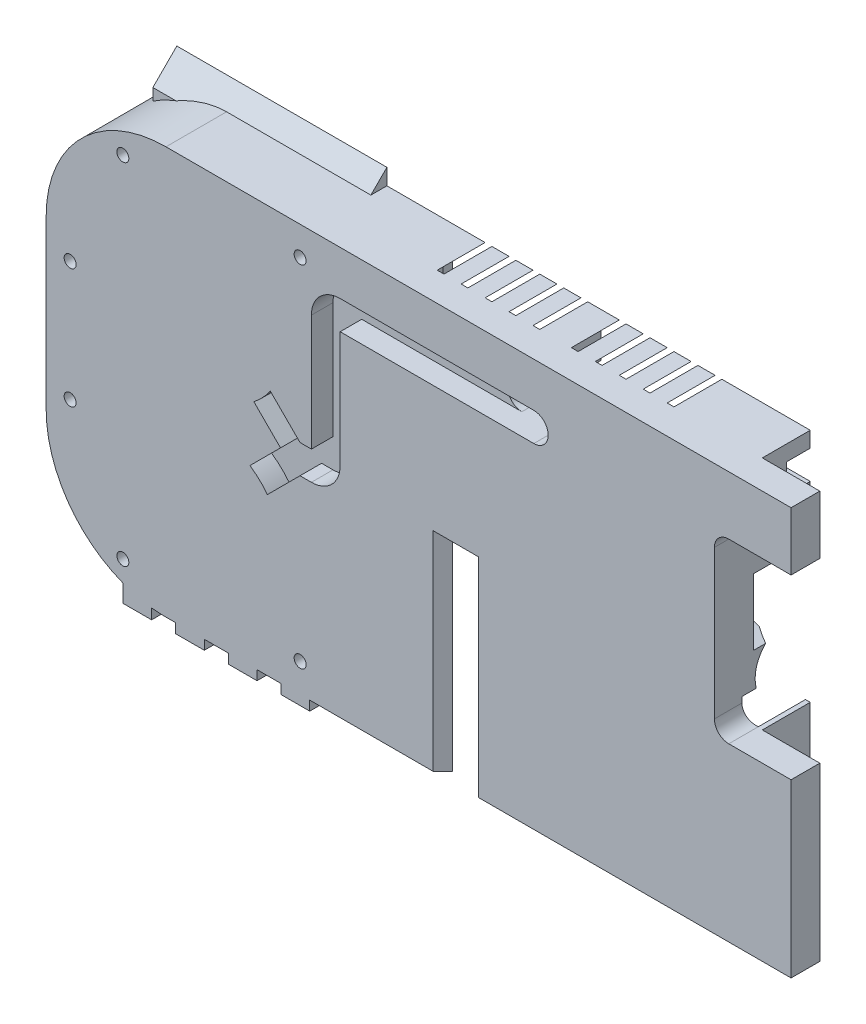
from build123d import *

# Parameters (mm, degrees)
BODY_DEPTH                    = 16
SKETCH24_W                    = 12
SKETCH24_H                    = 12.169980526
SKETCH24_H_2                  = 35.830019474
HANDLE_MATE_DEPTH             = 10
AIM_START                     = -5
AIM_DEPTH                     = 5
AIM_START_2                   = -11.5137
AIM_CHAMF_DEPTH               = 0.5137
AIM_START_3                   = -17
AIM_CHAMF_2_DEPTH             = 5.4863
AIM_START_4                   = -89.369387646
AIM_CHAMF_3_DEPTH             = 43.844504749
CLIP_BODY_CLEARANCE_DEPTH     = 40
CLIP_HEAD_CLEARANCE_DEPTH     = 13
CLIP_WINDOW_REACH             = 162.768
SKETCH30_W                    = 5.5
SKETCH30_H                    = 41.5
CLIP_WINDOW_CHAMF_SIZE        = 2
CLIP_SCREW_M3_D               = 2.5
CLIP_SCREW_M3_DEPTH           = 16
CLIP_SCREW_M3_TIP             = 0.751075774
DART_CLEARANCE_REACH          = 201.715
SKETCH6_R                     = 7.5
SKETCH15_R                    = 6.85
DRIVE_PULLEY_CLEARANCE_DEPTH  = 5.5
SKETCH16_R                    = 4.995
DRIVE_BEARING_CLEARANCE_DEPTH = 14
ESC_WIRE_GUIDE_DEPTH          = 4.5
ESC_WIRE_FEEDTROUGH_REACH     = 162.383
ESC_CLEARANCE_DEPTH           = 10
ESC_WIRE_CLEARANCE_DEPTH      = 5
BODY_SCREW_M3_D               = 2.5
CUT_EXTRUDE1_DEPTH            = 4
DRIVE_MOTOR_SCREW_D           = 2.5
DRIVE_MOTOR_SCREW_DEPTH       = 11
DRIVE_MOTOR_SCREW_TIP         = 0.751075774
DRIVE_MOTOR_EAR_DEPTH         = 3.8


with BuildPart() as part:
    # Sketch2 → body (new body)
    with BuildSketch(Plane.XY):
        with BuildLine():
            Line((-75.634238464, 36), (-73.634238464, 36))
            Line((-73.634238464, 36), (-73.634238464, 34))
            Line((-73.634238464, 34), (-67.634238464, 34))
            Line((-67.634238464, 34), (-67.634238464, 36))
            Line((-67.634238464, 36), (-62.634238464, 36))
            Line((-62.634238464, 36), (-62.634238464, 34))
            Line((-62.634238464, 34), (-56.634238464, 34))
            Line((-56.634238464, 34), (-56.634238464, 36))
            Line((-56.634238464, 36), (-51.634238464, 36))
            Line((-51.634238464, 36), (-51.634238464, 34))
            Line((-51.634238464, 34), (-45.634238464, 34))
            Line((-45.634238464, 34), (-45.634238464, 36))
            Line((-45.634238464, 36), (54.822790886, 36))
            Line((54.822790886, 36), (54.822790886, 66.789018034))
            Line((54.822790886, 66.789018034), (54.822790886, 71.830019474))
            Line((54.822790886, 71.830019474), (41.822790886, 71.830019474))
            ThreePointArc((41.822790886, 71.830019474), (39.701470543, 72.708699131), (38.822790886, 74.830019474))
            Line((38.822790886, 74.830019474), (38.822790886, 105.830019474))
            ThreePointArc((38.822790886, 105.830019474), (39.701470543, 107.951339818), (41.822790886, 108.830019474))
            Line((41.822790886, 108.830019474), (54.822790886, 108.830019474))
            Line((54.822790886, 108.830019474), (54.822790886, 121))
            Line((54.822790886, 121), (-75.634238464, 121))
            ThreePointArc((-75.634238464, 121), (-93.311907994, 113.67766953), (-100.634238464, 96))
            Line((-100.634238464, 96), (-100.634238464, 61))
            ThreePointArc((-100.634238464, 61), (-96.249766592, 46.857864376), (-84.634238464, 37.676192421))
            Line((-84.634238464, 37.676192421), (-84.634238464, 34))
            Line((-84.634238464, 34), (-78.634238464, 34))
            Line((-78.634238464, 34), (-78.634238464, 36.180652708))
            ThreePointArc((-78.634238464, 36.180652708), (-77.13695562, 36.045204045), (-75.634238464, 36))
        make_face()
    extrude(amount=-BODY_DEPTH)

    # Sketch24 → handle mate (cut)
    with BuildSketch(Plane(origin=(0, 0, -16), x_dir=(-1, 0, 0), z_dir=(0, 0, -1))):
        with Locations((-48.822790886, 114.915009737)):
            Rectangle(SKETCH24_W, SKETCH24_H)
        with Locations((-48.822790886, 53.915009737)):
            Rectangle(SKETCH24_W, SKETCH24_H_2)
    extrude(amount=-HANDLE_MATE_DEPTH, mode=Mode.SUBTRACT)

    # Sketch17 → aim (add)
    with BuildSketch(Plane(origin=(0, 0, -16), x_dir=(-1, 0, 0), z_dir=(0, 0, -1)).offset(AIM_START)):
        with BuildLine():
            Line((45.524882897, 121), (75.634238464, 121))
            ThreePointArc((75.634238464, 121), (82.802842896, 119.950179759), (89.369387646, 116.88888884))
            Line((89.369387646, 116.88888884), (89.369387646, 121))
            Line((89.369387646, 121), (89.369387646, 125.350689058))
            Line((89.369387646, 125.350689058), (45.524882897, 125.350689058))
            Line((45.524882897, 125.350689058), (45.524882897, 121))
        make_face()
    extrude(amount=AIM_DEPTH)

    # aim chamf: read off the stored shape, not the designer's step
    # aim chamf outline → aim chamf (cut)
    with BuildSketch(Plane.XY.offset(AIM_START_2)):
        with BuildLine():
            ThreePointArc((-89.369387646, 116.88888884), (-82.802842896, 119.950179759), (-75.634238464, 121))
            Line((-75.634238464, 121), (-45.524882897, 121))
            Line((-45.524882897, 121), (-45.524882897, 125.350689058))
            Line((-45.524882897, 125.350689058), (-89.369387646, 125.350689058))
            Line((-89.369387646, 125.350689058), (-89.369387646, 116.88888884))
        make_face()
    extrude(amount=AIM_CHAMF_DEPTH, mode=Mode.SUBTRACT)

    # aim chamf 2 outline → aim chamf 2 (cut)
    with BuildSketch(Plane.XY.offset(AIM_START_3)):
        with BuildLine():
            Line((-89.369387646, 125.350689058), (-89.369387651, 116.888888837))
            ThreePointArc((-89.369387651, 116.888888837), (-82.802842899, 119.950179758), (-75.634238464, 121))
            Line((-75.634238464, 121), (-45.524882897, 121))
            Line((-45.524882897, 121), (-45.524882897, 125.350689058))
            Line((-45.524882897, 125.350689058), (-89.369387646, 125.350689058))
        make_face()
    extrude(amount=AIM_CHAMF_2_DEPTH, mode=Mode.SUBTRACT)

    # aim chamf 3 outline → aim chamf 3 (add)
    with BuildSketch(Plane.YZ.offset(AIM_START_4)):
        Polygon((124.350689058, -16), (119.350689058, -11), (116.88888884, -11), (116.88888884, -16), align=None)
    extrude(amount=AIM_CHAMF_3_DEPTH)

    # Sketch4 → clip body clearance (cut)
    with BuildSketch(Plane.XZ.offset(-36)):
        Polygon((-40.177209114, -16), (-40.177209114, -6.392987644), (-30.177209114, -4.859654311), (-30.177209114, -5.266666667), (-28.677209114, -5.036666667), (-28.677209114, -4.629654311), (-25.177209114, -4.092987644), (-25.177209114, -2), (-11.777209114, -2), (-11.777209114, -3), (-10.177209114, -3), (-10.177209114, -2), (11.822790886, -2), (11.822790886, -3), (13.422790886, -3), (13.422790886, -2), (24.320032834, -2), (24.320032834, -6.5), (28.820032834, -6.5), (28.820032834, -4.19923141), (30.222790886, -4.414320978), (30.222790886, -5.021333333), (31.822790886, -5.266666667), (31.822790886, -4.659654311), (41.822790886, -6.192987644), (41.822790886, -16), align=None)
    extrude(amount=-CLIP_BODY_CLEARANCE_DEPTH, mode=Mode.SUBTRACT)

    # Sketch5 → clip head clearance (cut)
    with BuildSketch(Plane.XZ.offset(-76)):
        Polygon((-11.777209114, -2), (-25.177209114, -2), (-25.177209114, -16), (24.320032834, -16), (24.320032834, -2), (13.422790886, -2), (13.422790886, -3), (11.822790886, -3), (11.822790886, -2), (-10.177209114, -2), (-10.177209114, -3), (-11.777209114, -3), align=None)
    extrude(amount=-CLIP_HEAD_CLEARANCE_DEPTH, mode=Mode.SUBTRACT)

    # Sketch30 → clip window (cut, up to next)
    with BuildSketch(Plane.XY, mode=Mode.PRIVATE) as clip_window_sk1:
        with Locations((-15.127209114, 56.75)):
            Rectangle(SKETCH30_W, SKETCH30_H)
    clip_window_tool1 = extrude(clip_window_sk1.sketch, amount=-CLIP_WINDOW_REACH, mode=Mode.PRIVATE) & part.part
    add(clip_window_tool1.solids().sort_by_distance((-15.127209, 56.75, 0))[0], mode=Mode.SUBTRACT)

    # clip window chamf
    clip_window_chamf_edges = [part.edges().sort_by_distance(p)[0] for p in [
        (-17.877209114, 56.75, 0),
        (-15.127209114, 77.5, 0),
        (-12.377209114, 56.75, 0),
    ]]
    chamfer(clip_window_chamf_edges, length=CLIP_WINDOW_CHAMF_SIZE - 0.0001)  # a hair under: the kernel refuses the full size

    # clip screw M3
    with Locations(Plane(origin=(0, 36, 0), x_dir=(-1, 0, 0), z_dir=(0, -1, 0))):
        with Locations((-51.822790886, 3), (42.177209114, 3)):
            Hole(CLIP_SCREW_M3_D / 2, depth=CLIP_SCREW_M3_DEPTH)
            with Locations((0, 0, -(CLIP_SCREW_M3_DEPTH + CLIP_SCREW_M3_TIP / 2))):  # 118° drill point
                Cone(0, CLIP_SCREW_M3_D / 2, CLIP_SCREW_M3_TIP, mode=Mode.SUBTRACT)

    # dart clearance: up to this face of the body (flat: up to its plane)
    dart_clearance_end = Plane(part.part.faces().sort_by_distance((38.822790886, 90.700198534, -7.92885583))[0])
    # Sketch6 → dart clearance (cut, up to the picked face)
    with BuildSketch(Plane.ZY.offset(100.634238464), mode=Mode.PRIVATE) as dart_clearance_sk1:
        with Locations((-16, 77.83)):
            Circle(SKETCH6_R)
    dart_clearance_tool1 = split(extrude(dart_clearance_sk1.sketch, amount=-DART_CLEARANCE_REACH, mode=Mode.PRIVATE), bisect_by=dart_clearance_end, keep=Keep.BOTH, mode=Mode.PRIVATE)
    add(dart_clearance_tool1.solids().sort_by(Axis((-100.634238, 77.83, -16), (1, 0, 0)))[0], mode=Mode.SUBTRACT)

    # Sketch15 → drive pulley clearance (cut)
    with BuildSketch(Plane(origin=(0, 0, -16), x_dir=(-1, 0, 0), z_dir=(0, 0, -1))):
        with Locations((24.271053221, 90.330019474)):
            Circle(SKETCH15_R)
    extrude(amount=-DRIVE_PULLEY_CLEARANCE_DEPTH, mode=Mode.SUBTRACT)

    # Sketch16 → drive bearing clearance (cut)
    with BuildSketch(Plane(origin=(0, 0, -16), x_dir=(-1, 0, 0), z_dir=(0, 0, -1))):
        with Locations((24.271053221, 90.330019474)):
            Circle(SKETCH16_R)
    extrude(amount=-DRIVE_BEARING_CLEARANCE_DEPTH, mode=Mode.SUBTRACT)

    # Sketch12 → ESC_wire guide (cut)
    with BuildSketch(Plane.XY):
        with BuildLine():
            Line((-54.463538274, 68.730778072), (-47.657190091, 75.537126255))
            Line((-47.657190091, 75.537126255), (-45.282431262, 75.537126255))
            ThreePointArc((-45.282431262, 75.537126255), (-41.039790575, 77.294485568), (-39.282431262, 81.537126255))
            Line((-39.282431262, 81.537126255), (-39.282431262, 105.754695514))
            Line((-39.282431262, 105.754695514), (1.136189252, 105.754695514))
            ThreePointArc((1.136189252, 105.754695514), (4.136189252, 108.754695514), (1.136189252, 111.754695514))
            Line((1.136189252, 111.754695514), (-39.282431262, 111.754695514))
            ThreePointArc((-39.282431262, 111.754695514), (-43.525071949, 109.997336202), (-45.282431262, 105.754695514))
            Line((-45.282431262, 105.754695514), (-45.282431262, 81.537126255))
            Line((-45.282431262, 81.537126255), (-47.657190091, 81.537126255))
            Line((-47.657190091, 81.537126255), (-53.868348267, 87.748284432))
            ThreePointArc((-53.868348267, 87.748284432), (-55.43672519, 85.789929436), (-57.291965399, 84.100833752))
            Line((-57.291965399, 84.100833752), (-51.728257902, 78.537126255))
            Line((-51.728257902, 78.537126255), (-58.110988955, 72.154395203))
            ThreePointArc((-58.110988955, 72.154395203), (-56.152633958, 70.586018281), (-54.463538274, 68.730778072))
        make_face()
    extrude(amount=-ESC_WIRE_GUIDE_DEPTH, mode=Mode.SUBTRACT)

    # Sketch13 → ESC_wire feedtrough (cut, up to next)
    with BuildSketch(Plane.XY.offset(-4.5), mode=Mode.PRIVATE) as esc_wire_feedtrough_sk1:
        with BuildLine():
            Line((1.136189252, 105.754695514), (-5.863810748, 105.754695514))
            ThreePointArc((-5.863810748, 105.754695514), (-8.863810748, 108.754695514), (-5.863810748, 111.754695514))
            Line((-5.863810748, 111.754695514), (1.136189252, 111.754695514))
            ThreePointArc((1.136189252, 111.754695514), (4.136189252, 108.754695514), (1.136189252, 105.754695514))
        make_face()
    esc_wire_feedtrough_tool1 = extrude(esc_wire_feedtrough_sk1.sketch, amount=-ESC_WIRE_FEEDTROUGH_REACH, mode=Mode.PRIVATE) & part.part
    add(esc_wire_feedtrough_tool1.solids().sort_by_distance((-2.363811, 108.754696, -4.5))[0], mode=Mode.SUBTRACT)

    # Sketch14 → ESC clearance (cut)
    with BuildSketch(Plane(origin=(0, 0, -16), x_dir=(-1, 0, 0), z_dir=(0, 0, -1))):
        Polygon((-24.136189252, 117.754695514), (-21.136189252, 117.754695514), (-24.381493737, 121), (-22.967280175, 121), (-19.721975689, 117.754695514), (-16.136189252, 117.754695514), (-19.381493737, 121), (-17.967280175, 121), (-14.721975689, 117.754695514), (-11.136189252, 117.754695514), (-14.381493737, 121), (-12.967280175, 121), (-9.721975689, 117.754695514), (-6.136189252, 117.754695514), (-9.381493737, 121), (-7.967280175, 121), (-4.721975689, 117.754695514), (-1.136189252, 117.754695514), (-4.381493737, 121), (-2.967280175, 121), (0.278024311, 117.754695514), (0.863810748, 117.754695514), (0.863810748, 111.047588733), (0.863810748, 108.754695514), (-4.136189252, 108.754695514), (-4.136189252, 111.754695514), (-24.136189252, 111.754695514), align=None)
        Polygon((8.863810748, 111.754695514), (28.863810748, 111.754695514), (28.863810748, 117.754695514), (28.278024311, 117.754695514), (25.032719825, 121), (23.618506263, 121), (26.863810748, 117.754695514), (23.278024311, 117.754695514), (20.032719825, 121), (18.618506263, 121), (21.863810748, 117.754695514), (18.278024311, 117.754695514), (15.032719825, 121), (13.618506263, 121), (16.863810748, 117.754695514), (13.278024311, 117.754695514), (10.032719825, 121), (8.618506263, 121), (11.863810748, 117.754695514), (8.278024311, 117.754695514), (5.032719825, 121), (3.618506263, 121), (6.863810748, 117.754695514), (3.863810748, 117.754695514), (3.863810748, 111.047588733), (3.863810748, 108.754695514), (8.863810748, 108.754695514), align=None)
    extrude(amount=-ESC_CLEARANCE_DEPTH, mode=Mode.SUBTRACT)

    # Sketch27 → ESC wire clearance (cut)
    with BuildSketch(Plane(origin=(0, 0, -16), x_dir=(-1, 0, 0), z_dir=(0, 0, -1))):
        Polygon((-27.259258709, 111.754695514), (-42.822790886, 111.754695514), (-42.822790886, 117.754695514), (-24.136189252, 117.754695514), (-24.136189252, 111.754695514), (28.863810748, 111.754695514), (28.863810748, 117.754695514), (31.863810748, 117.754695514), (31.863810748, 111.7043782), (31.863810748, 108.754695514), (-24.136189252, 108.754695514), (-27.259258709, 108.754695514), align=None)
    extrude(amount=-ESC_WIRE_CLEARANCE_DEPTH, mode=Mode.SUBTRACT)

    # body screw M3 (through all)
    with Locations(Plane(origin=(0, 0, -16), x_dir=(-1, 0, 0), z_dir=(0, 0, -1))):
        with Locations((47.634238464, 42), (84.634238464, 42), (84.634238464, 115), (47.634238464, 115), (95.634238464, 90.33), (95.634238464, 65.33)):
            Hole(BODY_SCREW_M3_D / 2)

    # Sketch31 → barrel connector (revolve, cut)
    with BuildSketch(Plane(origin=(0, 0, -16), x_dir=(-1, 0, 0), z_dir=(0, 0, -1))):
        Polygon((100.634238464, 85.33), (93.134238464, 85.33), (93.134238464, 87.33), (93.134238464, 92.83), (98.134238464, 92.83), (98.134238464, 87.33), (100.634238464, 87.33), align=None)
    revolve(axis=Axis((-91.139966555, 77.83, -16), (-1, 0, 0)), mode=Mode.SUBTRACT)

    # Sketch7 → Cut-Extrude1 (cut)
    with BuildSketch(Plane(origin=(0, 0, -16), x_dir=(-1, 0, 0), z_dir=(0, 0, -1))):
        with BuildLine():
            Line((-38.822790886, 97.18), (-38.822790886, 83.48))
            Line((-38.822790886, 83.48), (27.639966555, 83.48))
            ThreePointArc((27.639966555, 83.48), (31.904685636, 90.33001088), (27.63998198, 97.180031362))
            Line((27.63998198, 97.180031362), (-38.822790886, 97.18))
        make_face()
    extrude(amount=-CUT_EXTRUDE1_DEPTH, mode=Mode.SUBTRACT)

    # drive motor screw
    with Locations(Plane(origin=(0, 0, -12), x_dir=(-1, 0, 0), z_dir=(0, 0, -1))):
        with Locations((-28.146189337, 90.282694826)):
            Hole(DRIVE_MOTOR_SCREW_D / 2, depth=DRIVE_MOTOR_SCREW_DEPTH)
            with Locations((0, 0, -(DRIVE_MOTOR_SCREW_DEPTH + DRIVE_MOTOR_SCREW_TIP / 2))):  # 118° drill point
                Cone(0, DRIVE_MOTOR_SCREW_D / 2, DRIVE_MOTOR_SCREW_TIP, mode=Mode.SUBTRACT)

    # Sketch36 → drive motor ear (cut)
    with BuildSketch(Plane(origin=(0, 0, -12), x_dir=(-1, 0, 0), z_dir=(0, 0, -1))):
        with BuildLine():
            Line((-38.822790886, 96.983356342), (-38.822790886, 83.132249853))
            Line((-38.822790886, 83.132249853), (-30.138086442, 86.616761129))
            ThreePointArc((-30.138086442, 86.616761129), (-27.659984341, 90.373224744), (-30.30762635, 94.012180735))
            Line((-30.30762635, 94.012180735), (-38.822790886, 96.983356342))
        make_face()
    extrude(amount=-DRIVE_MOTOR_EAR_DEPTH, mode=Mode.SUBTRACT)


solid = part.part
